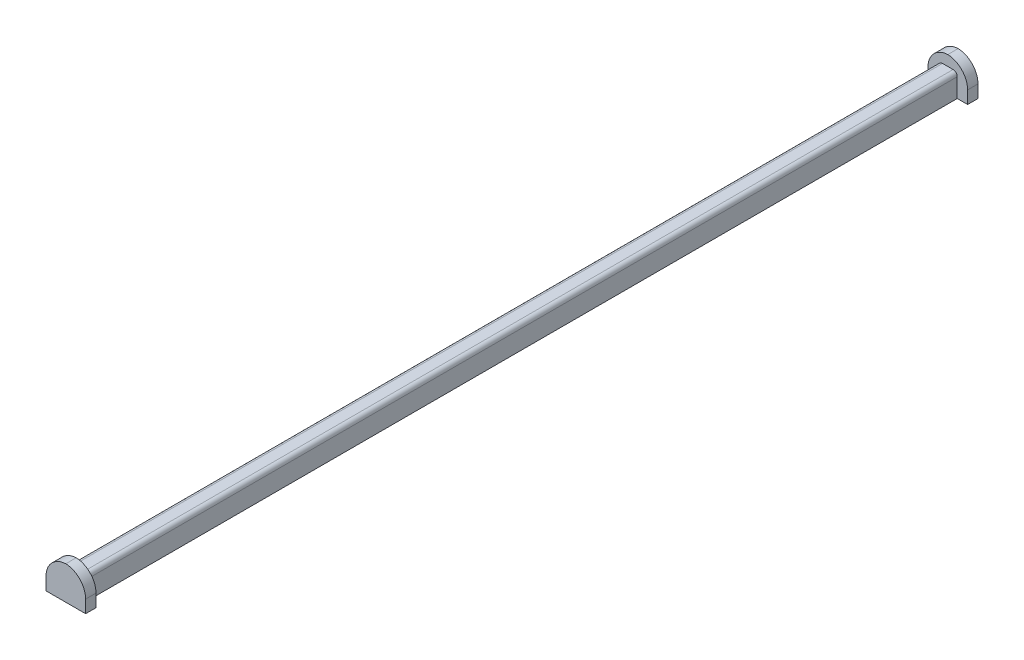
from build123d import *

# Parameters (mm, degrees)
BOSS_EXTRUDE1_DEPTH  = 133.35
SKETCH2_W            = 6.06425
SKETCH2_H            = 5.11175
BOSS_EXTRUDE2_DEPTH  = 1.5875
FILLET1_R            = 3.175
FILLET1_OF_MIRROR1_R = 3.175
FILLET2_R            = 0.635


with BuildPart() as part:
    # Sketch1 → Boss-Extrude1 (new body)
    with BuildSketch(Plane.XY):
        Polygon((0.142875, 3.667125), (3.032125, 3.667125), (3.032125, 1.905), (3.032125, 0.142875), (0.142875, 0.142875), (0.142875, 1.905), align=None)
    extrude(amount=BOSS_EXTRUDE1_DEPTH)

    # Sketch2 → Boss-Extrude2 (add)
    with BuildSketch(Plane.XY.offset(133.35)):
        with Locations((1.5875, 2.69875)):
            Rectangle(SKETCH2_W, SKETCH2_H)
    boss_extrude2 = extrude(amount=BOSS_EXTRUDE2_DEPTH)

    # Fillet1
    # the kernel refuses this fillet: 3.175 mm, written as the material it takes off along each edge
    with BuildSketch(Plane(origin=(-1.444625, 5.254625, 125.4125), x_dir=(0, -1, 0), z_dir=(0, 0, 1))) as fillet1_piece_1:
        with BuildLine():
            CenterArc((FILLET1_R, FILLET1_R), FILLET1_R, 180, 90)
            Line((0, FILLET1_R), (0, 0))
            Line((0, 0), (FILLET1_R, 0))
        make_face()
    extrude(amount=17.4625, mode=Mode.SUBTRACT)
    with BuildSketch(Plane(origin=(4.619625, 5.254625, 125.4125), x_dir=(0, -1, 0), z_dir=(0, 0, 1))) as fillet1_piece_2:
        with BuildLine():
            CenterArc((FILLET1_R, -FILLET1_R), FILLET1_R, 90, 90)
            Line((0, -FILLET1_R), (0, 0))
            Line((0, 0), (FILLET1_R, 0))
        make_face()
    extrude(amount=17.4625, mode=Mode.SUBTRACT)

    # Mirror1: Boss-Extrude2 across plane
    add(boss_extrude2.mirror(Plane.XY.offset(66.675)))

    # Fillet1 of Mirror1
    # the kernel refuses this fillet: 3.175 mm, written as the material it takes off along each edge
    with BuildSketch(Plane(origin=(-1.444625, 5.254625, 7.9375), x_dir=(0, -1, 0), z_dir=(0, 0, -1))) as fillet1_of_mirror1_piece_1:
        with BuildLine():
            CenterArc((FILLET1_OF_MIRROR1_R, -FILLET1_OF_MIRROR1_R), FILLET1_OF_MIRROR1_R, 90, 90)
            Line((0, -FILLET1_OF_MIRROR1_R), (0, 0))
            Line((0, 0), (FILLET1_OF_MIRROR1_R, 0))
        make_face()
    extrude(amount=17.4625, mode=Mode.SUBTRACT)
    with BuildSketch(Plane(origin=(4.619625, 5.254625, 7.9375), x_dir=(0, -1, 0), z_dir=(0, 0, -1))) as fillet1_of_mirror1_piece_2:
        with BuildLine():
            CenterArc((FILLET1_OF_MIRROR1_R, FILLET1_OF_MIRROR1_R), FILLET1_OF_MIRROR1_R, 180, 90)
            Line((0, FILLET1_OF_MIRROR1_R), (0, 0))
            Line((0, 0), (FILLET1_OF_MIRROR1_R, 0))
        make_face()
    extrude(amount=17.4625, mode=Mode.SUBTRACT)

    # Fillet2
    fillet2_edges = [part.edges().sort_by_distance(p)[0] for p in [
        (3.032125, 3.667125, 66.675),
        (0.142875, 3.667125, 66.675),
    ]]
    fillet(fillet2_edges, radius=FILLET2_R)


solid = part.part
